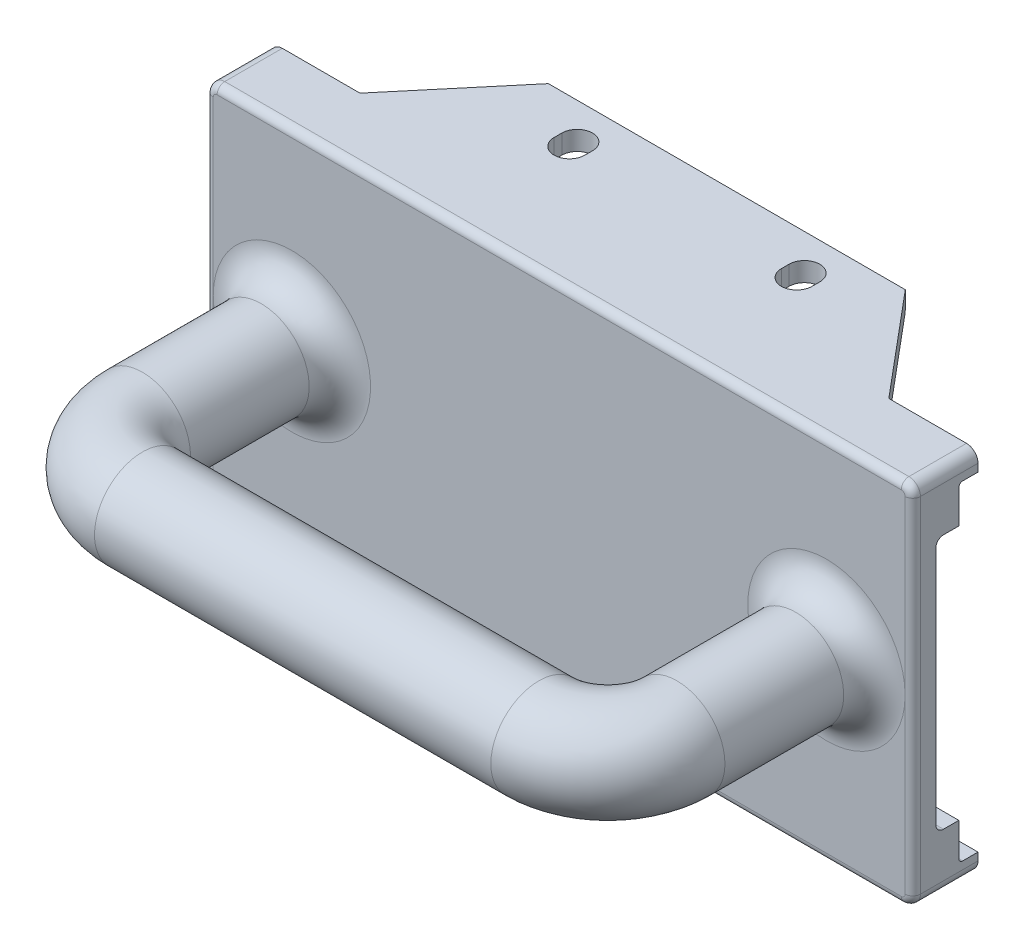
from build123d import *

# Parameters (mm, degrees)
SADDLE_DEPTH        = 92.15
SKIRT_CUT_X_DEPTH   = 48.875
SKIRT_CUT_X_2_DEPTH = 48.875
BAIL_LEGS_SKETCH_R  = 12.5
BAIL_LEGS_DEPTH     = 19.975
GRIP_BAR_SKETCH_R   = 12.5
GRIP_BAR_DEPTH      = 51.65
ELBOW_X_SKETCH_R    = 12.5
ELBOW_X_ANGLE       = 90
ELBOW_X_SKETCH_2_R  = 12.5
ELBOW_X_2_ANGLE     = 90
M6_SLOTS_X_DEPTH    = 48.875
M6_SLOTS_X_2_DEPTH  = 48.875
BAIL_BASE_X_R       = 8
BAIL_BASE_X_2_R     = 8
RECESS_CORNERS_R    = 2
LAND_CORNERS_R      = 1
ROOF_CORNERS_R      = 3
ROOF_TOP_EDGE_R     = 2
BED_CHAMFER_SIZE    = 0.6


with BuildPart() as part:
    # saddle sketch → saddle (new, symmetric)
    with BuildSketch(Plane(origin=(0, 0, 0), x_dir=(0, 0, -1), z_dir=(1, 0, 0))):
        Polygon((32.3, 47.875), (-12, 47.875), (-12, -47.875), (32.3, -47.875), (32.3, -43.875), (31.3, -42.875), (0, -42.875), (0, -33.215), (-6, -33.215), (-6, 33.215), (0, 33.215), (0, 42.875), (31.3, 42.875), (32.3, 43.875), align=None)
    extrude(amount=SADDLE_DEPTH, both=True)

    # Sketch2 → skirt cut _x (cut, symmetric)
    with BuildSketch(Plane(origin=(0, 0, 0), x_dir=(1, 0, 0), z_dir=(0, 1, 0))):
        Polygon((46, 33.3), (46, 32.3), (68.907419931, 5), (93.15, 5), (93.15, 33.3), align=None)
    extrude(amount=SKIRT_CUT_X_DEPTH, both=True, mode=Mode.SUBTRACT)

    # Sketch3 → skirt cut -x 2 (cut, symmetric)
    with BuildSketch(Plane(origin=(0, 0, 0), x_dir=(1, 0, 0), z_dir=(0, 1, 0))):
        Polygon((-46, 33.3), (-46, 32.3), (-68.907419931, 5), (-93.15, 5), (-93.15, 33.3), align=None)
    extrude(amount=SKIRT_CUT_X_2_DEPTH, both=True, mode=Mode.SUBTRACT)

    # bail legs sketch → bail legs (add, symmetric)
    with BuildSketch(Plane.XY.offset(30.975)):
        with Locations(Location((69.65, 0, 0), (0, 0, 180))):
            Circle(BAIL_LEGS_SKETCH_R)
        with Locations(Location((-69.65, 0, 0), (0, 0, 180))):
            Circle(BAIL_LEGS_SKETCH_R)
    extrude(amount=BAIL_LEGS_DEPTH, both=True)



with BuildPart() as body_2:
    # grip bar sketch → grip bar (new, symmetric)
    with BuildSketch(Plane(origin=(0, 0, 0), x_dir=(0, 0, -1), z_dir=(1, 0, 0))):
        with Locations((-68.95, 0)):
            Circle(GRIP_BAR_SKETCH_R)
    extrude(amount=GRIP_BAR_DEPTH, both=True)


with BuildPart() as part_1:
    add(part.part)

    add(body_2.part)  # elbow _x merges body 2
    # elbow _x sketch → elbow _x (revolve)
    with BuildSketch(Plane(origin=(51.65, 0, 0), x_dir=(0, 0, -1), z_dir=(1, 0, 0))):
        with Locations(Location((-68.95, 0, 0), (0, 0, 180))):
            Circle(ELBOW_X_SKETCH_R)
    revolve(axis=Axis((51.65, -30, 50.95), (0, 1, 0)), revolution_arc=ELBOW_X_ANGLE)

    # elbow -x sketch 2 → elbow -x 2 (revolve)
    with BuildSketch(Plane(origin=(-51.65, 0, 0), x_dir=(0, 0, -1), z_dir=(1, 0, 0))):
        with Locations(Location((-68.95, 0, 0), (0, 0, 180))):
            Circle(ELBOW_X_SKETCH_2_R)
    revolve(axis=Axis((-51.65, -30, 50.95), (0, -1, 0)), revolution_arc=ELBOW_X_2_ANGLE)

    # Sketch9 → M6 slots _x (cut, symmetric)
    with BuildSketch(Plane(origin=(0, 0, 0), x_dir=(1, 0, 0), z_dir=(0, 1, 0))):
        with BuildLine():
            Line((25.605, 22.3), (25.605, 20.3))
            ThreePointArc((25.605, 20.3), (29.605, 16.3), (33.605, 20.3))
            Line((33.605, 20.3), (33.605, 22.3))
            ThreePointArc((33.605, 22.3), (29.605, 26.3), (25.605, 22.3))
        make_face()
    extrude(amount=M6_SLOTS_X_DEPTH, both=True, mode=Mode.SUBTRACT)

    # Sketch10 → M6 slots -x 2 (cut, symmetric)
    with BuildSketch(Plane(origin=(0, 0, 0), x_dir=(1, 0, 0), z_dir=(0, 1, 0))):
        with BuildLine():
            Line((-33.605, 22.3), (-33.605, 20.3))
            ThreePointArc((-33.605, 20.3), (-29.605, 16.3), (-25.605, 20.3))
            Line((-25.605, 20.3), (-25.605, 22.3))
            ThreePointArc((-25.605, 22.3), (-29.605, 26.3), (-33.605, 22.3))
        make_face()
    extrude(amount=M6_SLOTS_X_2_DEPTH, both=True, mode=Mode.SUBTRACT)

    # bail base _x
    bail_base_x_edges = [part_1.edges().sort_by_distance(p)[0] for p in [
        (82.15, 0, 12),
    ]]
    fillet(bail_base_x_edges, radius=BAIL_BASE_X_R)

    # bail base -x 2
    bail_base_x_2_edges = [part_1.edges().sort_by_distance(p)[0] for p in [
        (-57.15, 0, 12),
    ]]
    fillet(bail_base_x_2_edges, radius=BAIL_BASE_X_2_R)

    # recess corners
    recess_corners_edges = [part_1.edges().sort_by_distance(p)[0] for p in [
        (0, 33.215, 6),
        (0, -33.215, 6),
    ]]
    fillet(recess_corners_edges, radius=RECESS_CORNERS_R)

    # land corners
    land_corners_edges = [part_1.edges().sort_by_distance(p)[0] for p in [
        (0, 42.875, 0),
        (0, -42.875, 0),
    ]]
    fillet(land_corners_edges, radius=LAND_CORNERS_R)

    # roof corners
    roof_corners_edges = [part_1.edges().sort_by_distance(p)[0] for p in [
        (92.15, -47.875, 3.5),
        (-92.15, -47.875, 3.5),
        (92.15, 47.875, 3.5),
        (-92.15, 47.875, 3.5),
    ]]
    fillet(roof_corners_edges, radius=ROOF_CORNERS_R)

    # roof top edge
    roof_top_edge_edges = [part_1.edges().sort_by_distance(p)[0] for p in [
        (0, -47.875, 12),
        (-92.15, 0, 12),
        (92.15, 0, 12),
        (0, 47.875, 12),
        (91.271320344, 46.996320344, 12),
        (91.271320344, -46.996320344, 12),
        (-91.271320344, 46.996320344, 12),
        (-91.271320344, -46.996320344, 12),
    ]]
    fillet(roof_top_edge_edges, radius=ROOF_TOP_EDGE_R - 0.0001)  # a hair under: the kernel refuses the full size

    # bed chamfer
    bed_chamfer_edges = [part_1.edges().sort_by_distance(p)[0] for p in [
        (0, -47.875, -32.3),
        (0, 47.875, -32.3),
    ]]
    chamfer(bed_chamfer_edges, length=BED_CHAMFER_SIZE)


solid = part_1.part
